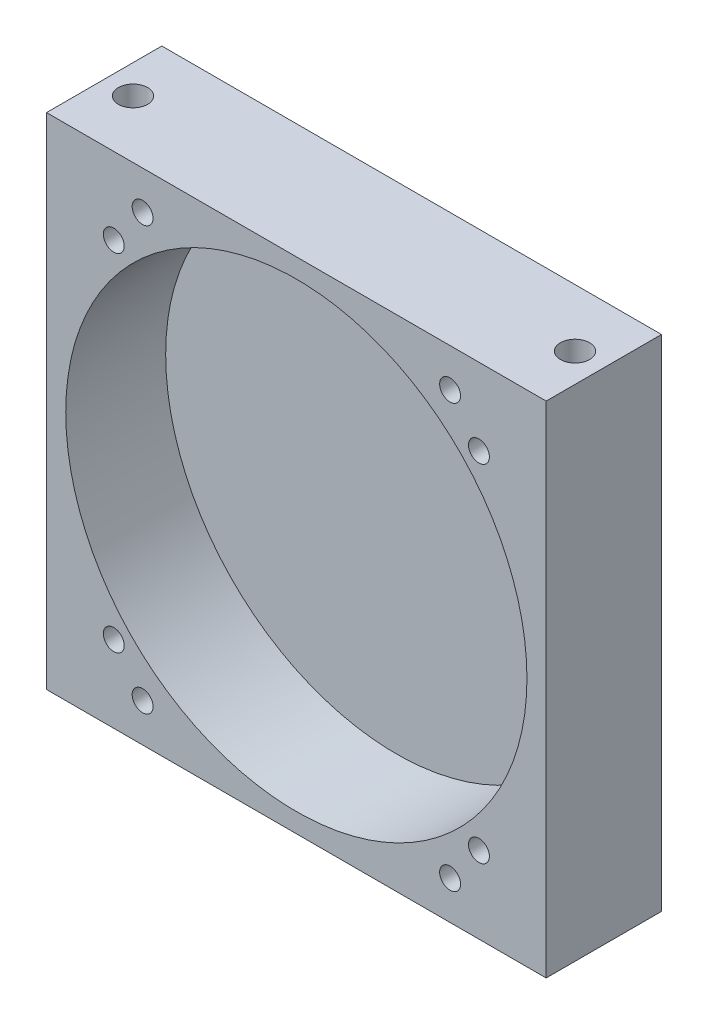
from build123d import *

# Parameters (mm, degrees)
SKETCH1_W                       = 82.55
SKETCH1_H                       = 82.55
BOSS_EXTRUDE1_DEPTH             = 19.05
SKETCH2_R                       = 38.1
CUT_EXTRUDE1_DEPTH              = 16.51
F_10_32_TAPPED_HOLE1_AT_2_COUNT = 2
F_10_32_TAPPED_HOLE1_AT_2_PITCH = 73.025
F_8_32_TAPPED_HOLE1_D           = 3.4544
F_8_32_TAPPED_HOLE1_DEPTH       = 16.002
F_8_32_TAPPED_HOLE1_TIP         = 1.037806461
F_8_32_TAPPED_HOLE2_D           = 3.4544
F_8_32_TAPPED_HOLE2_DEPTH       = 16.002
F_8_32_TAPPED_HOLE2_TIP         = 1.037806461


with BuildPart() as part:
    # Sketch1 → Boss-Extrude1 (new body)
    with BuildSketch(Plane.XY):
        Rectangle(SKETCH1_W, SKETCH1_H)
    extrude(amount=BOSS_EXTRUDE1_DEPTH)

    # Sketch2 → Cut-Extrude1 (cut)
    with BuildSketch(Plane.XY.offset(19.05)):
        Circle(SKETCH2_R)
    extrude(amount=-CUT_EXTRUDE1_DEPTH, mode=Mode.SUBTRACT)

    # Sketch3 → #10-32 Tapped Hole1 (revolve, cut)
    with BuildSketch(Plane(origin=(-36.5125, 41.275, 9.525), x_dir=(0, 0, 1), z_dir=(1, 0, 0))):
        Polygon((0, 0), (0, 20.263317848), (2.0193, 19.05), (2.0193, 18.288), (2.413, 18.288), (2.413, 0), align=None)
    f_10_32_tapped_hole1 = revolve(axis=Axis((-36.5125, 47.625, 9.525), (0, -1, 0)), mode=Mode.SUBTRACT)

    # #10-32 Tapped Hole1 at 2: #10-32 Tapped Hole1 ×2
    with Locations(*[(i * F_10_32_TAPPED_HOLE1_AT_2_PITCH, 0, 0) for i in range(1, F_10_32_TAPPED_HOLE1_AT_2_COUNT)]):
        add(f_10_32_tapped_hole1, mode=Mode.SUBTRACT)

    # Mirror1: #10-32 Tapped Hole1 across plane
    add(f_10_32_tapped_hole1.mirror(Plane.ZX), mode=Mode.SUBTRACT)

    # Mirror1 copy 1 sketch → Mirror1 copy 1 (revolve, cut)
    with BuildSketch(Plane(origin=(36.5125, -41.275, 9.525), x_dir=(0, 0, 1), z_dir=(1, 0, 0))):
        Polygon((0, 0), (0, -20.263317848), (2.0193, -19.05), (2.0193, -18.288), (2.413, -18.288), (2.413, 0), align=None)
    revolve(axis=Axis((36.5125, -47.625, 9.525), (0, -1, 0)), mode=Mode.SUBTRACT)

    # #8-32 Tapped Hole1
    with Locations(Plane.XY.offset(19.05)):
        with Locations((25.4, -34.925), (-25.4, -34.925), (-25.4, 34.925), (25.4, 34.925)):
            Hole(F_8_32_TAPPED_HOLE1_D / 2, depth=F_8_32_TAPPED_HOLE1_DEPTH)
            with Locations((0, 0, -(F_8_32_TAPPED_HOLE1_DEPTH + F_8_32_TAPPED_HOLE1_TIP / 2))):  # 118° drill point
                Cone(0, F_8_32_TAPPED_HOLE1_D / 2, F_8_32_TAPPED_HOLE1_TIP, mode=Mode.SUBTRACT)

    # #8-32 Tapped Hole2
    with Locations(Plane.XY.offset(19.05)):
        with Locations((30.1625, -28.575), (-30.1625, 28.575), (-30.1625, -28.575), (30.1625, 28.575)):
            Hole(F_8_32_TAPPED_HOLE2_D / 2, depth=F_8_32_TAPPED_HOLE2_DEPTH)
            with Locations((0, 0, -(F_8_32_TAPPED_HOLE2_DEPTH + F_8_32_TAPPED_HOLE2_TIP / 2))):  # 118° drill point
                Cone(0, F_8_32_TAPPED_HOLE2_D / 2, F_8_32_TAPPED_HOLE2_TIP, mode=Mode.SUBTRACT)


solid = part.part
